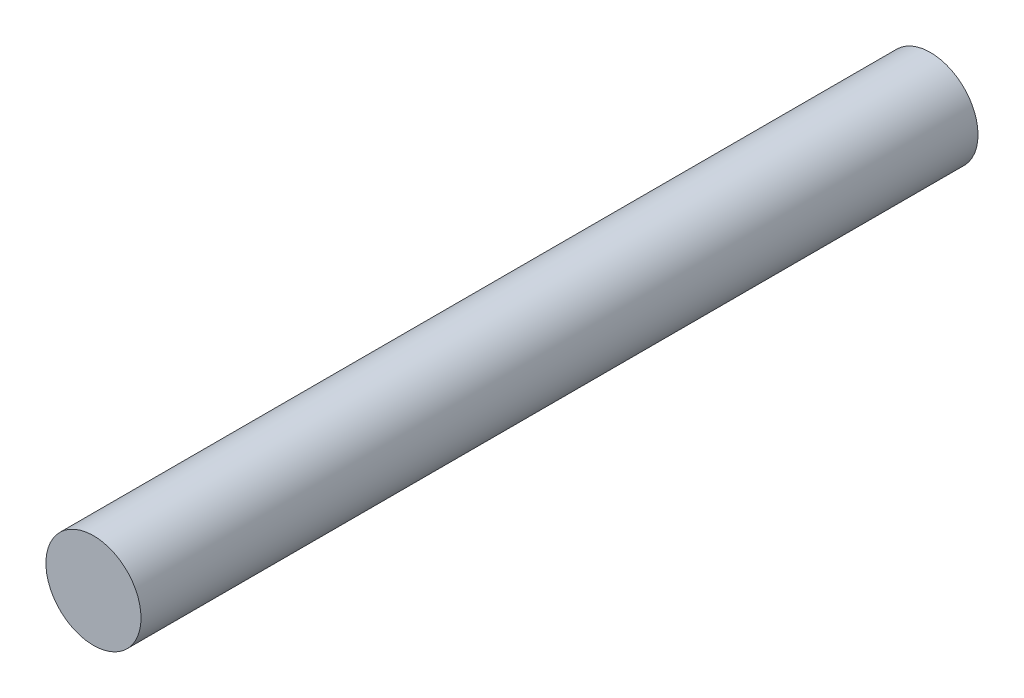
from build123d import *

# Parameters (mm, degrees)
SKETCH1_R           = 2.5
BOSS_EXTRUDE1_DEPTH = 44


with BuildPart() as part:
    # Sketch1 → Boss-Extrude1 (new body)
    with BuildSketch(Plane.XY):
        Circle(SKETCH1_R)
    extrude(amount=BOSS_EXTRUDE1_DEPTH)


solid = part.part
